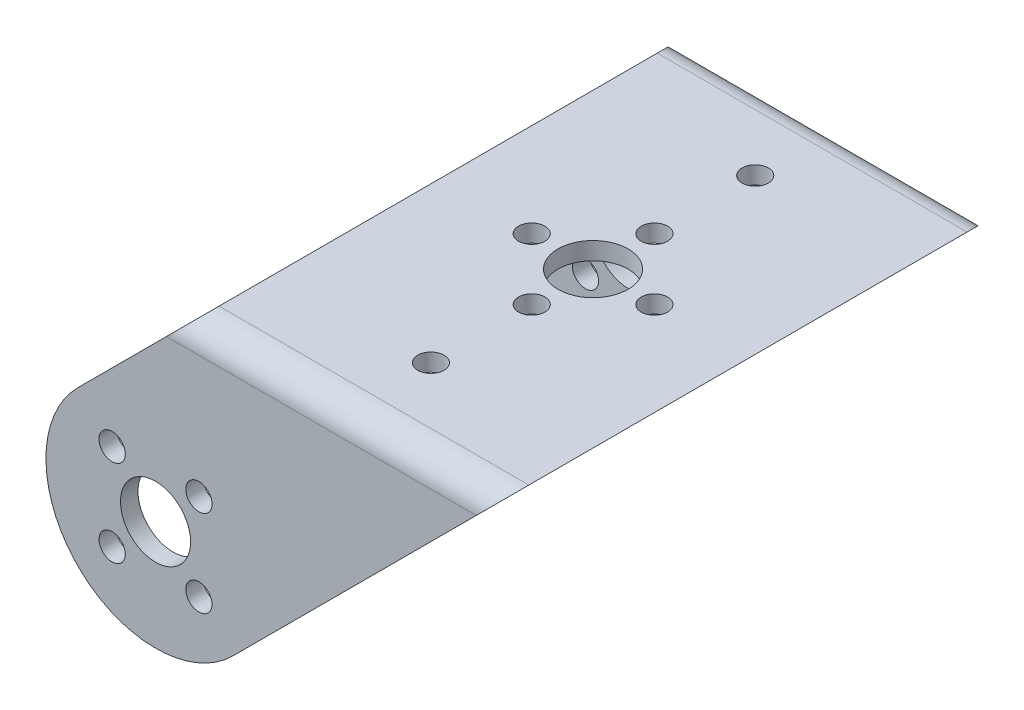
from build123d import *

# Parameters (mm, degrees)
SKETCH_1_R          = 4
SKETCH_1_R_2        = 1.5
EXTRUDE_1_DEPTH     = 2
EXTRUDE_2_DEPTH     = 52
EXTRUDE_START       = 2
SKETCH_3_R          = 4
SKETCH_3_R_2        = 1.5
EXTRUDE_3_DEPTH     = 2
FILLET_1_R          = 3
FILLET_2_R          = 1
SKETCH_4_R          = 4
SKETCH_4_R_2        = 1.5
CUT_EXTRUDE_1_DEPTH = 2
SKETCH_5_R          = 1.5
CUT_EXTRUDE_2_DEPTH = 2


with BuildPart() as part:
    # 草图1 → 凸台-拉伸1 (new body)
    with BuildSketch(Plane.XY):
        with BuildLine():
            Line((8.838834765, -8.838834765), (39.597979746, 21.920310217))
            Line((39.597979746, 21.920310217), (4.242640687, 21.920310217))
            Line((4.242640687, 21.920310217), (-8.838834765, 8.838834765))
            ThreePointArc((-8.838834765, 8.838834765), (-8.838834765, -8.838834765), (8.838834765, -8.838834765))
        make_face()
        Circle(SKETCH_1_R, mode=Mode.SUBTRACT)
        with Locations((4.949747468, -4.949747468)):
            Circle(SKETCH_1_R_2, mode=Mode.SUBTRACT)
        with Locations((-4.949747468, -4.949747468)):
            Circle(SKETCH_1_R_2, mode=Mode.SUBTRACT)
        with Locations((-4.949747468, 4.949747468)):
            Circle(SKETCH_1_R_2, mode=Mode.SUBTRACT)
        with Locations((4.949747468, 4.949747468)):
            Circle(SKETCH_1_R_2, mode=Mode.SUBTRACT)
    extrude(amount=EXTRUDE_1_DEPTH)

    # 草图2 → 凸台-拉伸2 (add)
    with BuildSketch(Plane(origin=(0, 0, 0), x_dir=(-1, 0, 0), z_dir=(0, 0, -1))):
        Polygon((-39.597979746, 21.920310217), (-4.242640687, 21.920310217), (-2.242640687, 19.920310217), (-37.597979746, 19.920310217), align=None)
    extrude(amount=EXTRUDE_2_DEPTH)

    # 草图3 → 凸台-拉伸3 (add)
    with BuildSketch(Plane(origin=(0, 0, -52), x_dir=(-1, 0, 0), z_dir=(0, 0, -1)).offset(EXTRUDE_START)):
        with BuildLine():
            Line((-2.242640687, 19.920310217), (-4.242640687, 21.920310217))
            Line((-4.242640687, 21.920310217), (-39.597979746, 21.920310217))
            Line((-39.597979746, 21.920310217), (-37.597979746, 19.920310217))
            Line((-37.597979746, 19.920310217), (-8.838834765, -8.838834765))
            ThreePointArc((-8.838834765, -8.838834765), (8.838834765, -8.838834765), (8.838834765, 8.838834765))
            Line((8.838834765, 8.838834765), (-2.242640687, 19.920310217))
        make_face()
        Circle(SKETCH_3_R, mode=Mode.SUBTRACT)
        with Locations((-4.949747468, -4.949747468)):
            Circle(SKETCH_3_R_2, mode=Mode.SUBTRACT)
        with Locations((-4.949747468, 4.949747468)):
            Circle(SKETCH_3_R_2, mode=Mode.SUBTRACT)
        with Locations((4.949747468, 4.949747468)):
            Circle(SKETCH_3_R_2, mode=Mode.SUBTRACT)
        with Locations((4.949747468, -4.949747468)):
            Circle(SKETCH_3_R_2, mode=Mode.SUBTRACT)
    extrude(amount=-EXTRUDE_3_DEPTH)

    # 圆角1
    fillet_1_edges = [part.edges().sort_by_distance(p)[0] for p in [
        (21.920310217, 21.920310217, 2),
        (21.920310217, 21.920310217, -54),
    ]]
    fillet(fillet_1_edges, radius=FILLET_1_R)

    # 圆角2
    fillet_2_edges = [part.edges().sort_by_distance(p)[0] for p in [
        (19.920310217, 19.920310217, 0),
        (19.920310217, 19.920310217, -52),
    ]]
    fillet(fillet_2_edges, radius=FILLET_2_R)

    # 草图4 → 切除-拉伸1 (cut)
    with BuildSketch(Plane(origin=(0, 21.920310217, 0), x_dir=(1, 0, 0), z_dir=(0, 1, 0))):
        with Locations((21.920310217, 26)):
            Circle(SKETCH_4_R)
        with Locations((14.920310217, 26)):
            Circle(SKETCH_4_R_2)
        with Locations((21.920310217, 33)):
            Circle(SKETCH_4_R_2)
        with Locations((28.920310217, 26)):
            Circle(SKETCH_4_R_2)
        with Locations((21.920310217, 19)):
            Circle(SKETCH_4_R_2)
    extrude(amount=-CUT_EXTRUDE_1_DEPTH, mode=Mode.SUBTRACT)

    # 草图5 → 切除-拉伸2 (cut)
    with BuildSketch(Plane(origin=(0, 21.920310217, 0), x_dir=(1, 0, 0), z_dir=(0, 1, 0))):
        with Locations((21.920310217, 44.5)):
            Circle(SKETCH_5_R)
        with Locations((21.920310217, 7.5)):
            Circle(SKETCH_5_R)
    extrude(amount=-CUT_EXTRUDE_2_DEPTH, mode=Mode.SUBTRACT)


solid = part.part
